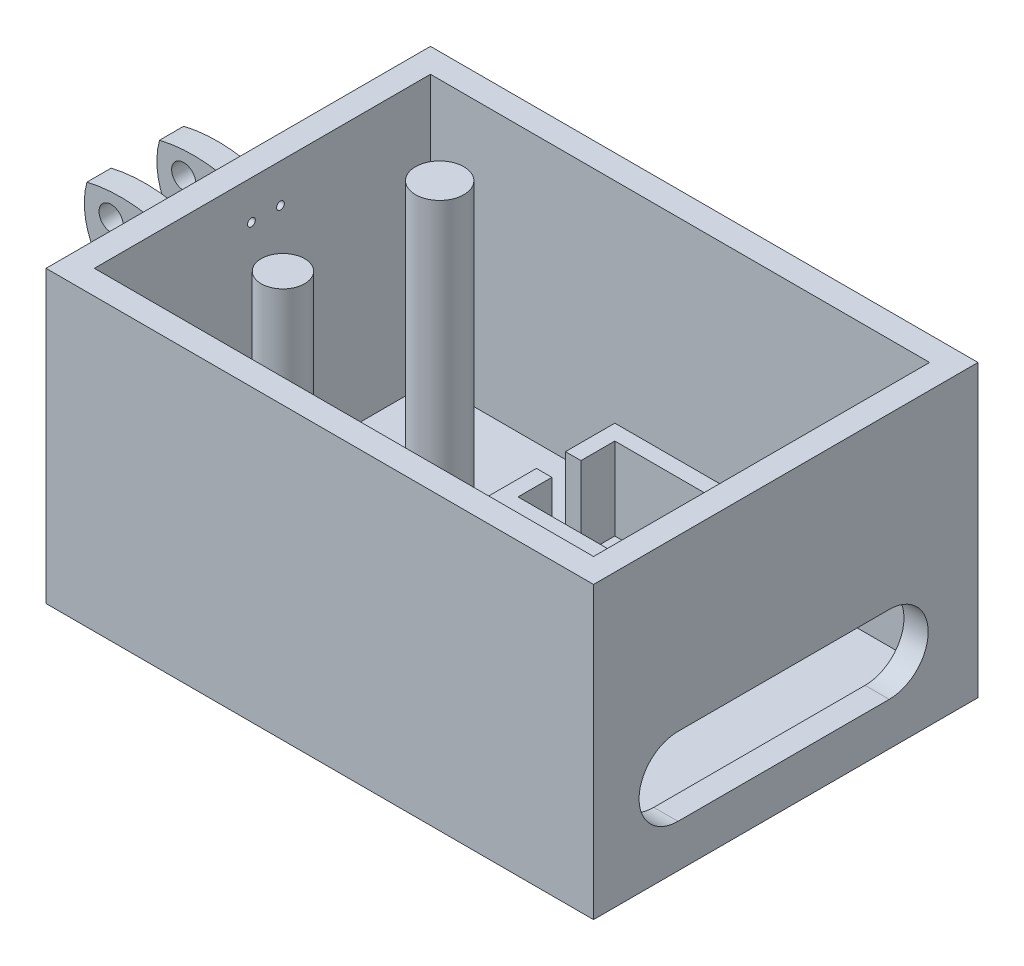
from build123d import *

# Parameters (mm, degrees)
BOSS_EXTRUDE1_DEPTH     = 38.1
CUT_EXTRUDE1_DEPTH      = 34.925
SERVO_BOX_1_DEPTH       = 13.97
SERVO_BOX_2_DEPTH       = 13.97
SKETCH36_R              = 1.5875
RING_ATTACHMENT_DEPTH   = 19.05
ATTACHMENT_TRIM_DEPTH   = 25.4
SKETCH33_R              = 0.508
RING_FINGER_HOLES_DEPTH = 31.75
CORD_HOLE_DEPTH         = 44.45
RING_HOOK_DEPTH         = 19.05
MIDDLE_HOOK_DEPTH       = 19.05
MIDDLE_HOOK_2_DEPTH     = 19.05
SKETCH57_W              = 6.44385504
SKETCH57_H              = 7.30367128
MIDDLE_HOOK_CUT_1_DEPTH = 19.05
SKETCH65_W              = 5.804806401
SKETCH65_H              = 9.582838289
SKETCH65_H_2            = 6.985
SKETCH65_W_2            = 10.36865681
SKETCH65_H_3            = 26.914043033
CUT_EXTRUDE9_DEPTH      = 15.24
CUT_EXTRUDE10_DEPTH     = 50.8
SKETCH67_R              = 2.848989685
SKETCH67_R_2            = 3.175
BOSS_EXTRUDE2_DEPTH     = 38.1


with BuildPart() as part:
    # Sketch2 → Boss-Extrude1 (new body)
    with BuildSketch(Plane(origin=(0, 0, 0), x_dir=(1, 0, 0), z_dir=(0, 1, 0))):
        with BuildLine():
            Line((-20.778406205, 52.758673202), (-36.188953289, 52.758673202))
            Line((-36.188953289, 52.758673202), (-36.188953289, 33.708673202))
            Line((-36.188953289, 33.708673202), (-38.864171838, 27.358673202))
            Line((-38.864171838, 27.358673202), (-48.947687906, 27.358673202))
            Line((-48.947687906, 27.358673202), (-48.947687906, 8.308673202))
            Line((-48.947687906, 8.308673202), (-48.947687906, -42.491326798))
            Line((-48.947687906, -42.491326798), (-42.959403849, -42.491326798))
            ThreePointArc((-42.959403849, -42.491326798), (-29.448791922, -45.239401215), (-16.422067996, -49.755263412))
            ThreePointArc((-16.422067996, -49.755263412), (-10.441569813, -54.6928899), (-3.738179712, -58.593027718))
            Line((-3.738179712, -58.593027718), (-3.738179712, -63.210333869))
            Line((-3.738179712, -63.210333869), (15.311820288, -63.210333869))
            ThreePointArc((15.311820288, -63.210333869), (19.123708761, -63.010602415), (22.909801598, -62.524919994))
            Line((22.909801598, -62.524919994), (22.909801598, 48.896004027))
            ThreePointArc((22.909801598, 48.896004027), (1.17082788, 52.016399628), (-20.778406205, 52.758673202))
        make_face()
    extrude(amount=BOSS_EXTRUDE1_DEPTH)

    # Sketch3 → Cut-Extrude1 (cut)
    with BuildSketch(Plane(origin=(0, 38.1, 0), x_dir=(1, 0, 0), z_dir=(0, 1, 0))):
        Polygon((-45.772687906, 24.183673202), (19.734801598, 24.183673202), (19.734801598, -19.921590233), (-45.772687906, -19.921590233), (-45.772687906, 7.713042295), align=None)
        with BuildLine():
            Line((-38.864171838, 27.358673202), (22.909801598, 27.358673202))
            ThreePointArc((22.909801598, 27.358673202), (-7.97718512, 133.680362497), (-38.864171838, 27.358673202))
        make_face()
        with BuildLine():
            Line((-48.947687906, -23.096590233), (22.909801598, -23.096590233))
            ThreePointArc((22.909801598, -23.096590233), (35.616611998, -147.942668358), (-48.947687906, -55.22327753))
            Line((-48.947687906, -55.22327753), (-48.947687906, -23.096590233))
        make_face()
    extrude(amount=-CUT_EXTRUDE1_DEPTH, mode=Mode.SUBTRACT)

    # Sketch6 → Servo Box 1 (add)
    with BuildSketch(Plane(origin=(0, 0, 0), x_dir=(1, 0, 0), z_dir=(0, 1, 0))):
        Polygon((-18.154039747, -9.466732857), (-16.122039747, -9.466732857), (-16.122039747, -13.911732857), (8.007960253, -13.911732857), (8.007960253, -9.466732857), (10.039960253, -9.466732857), (10.039960253, -15.943732857), (-18.154039747, -15.943732857), align=None)
        Polygon((8.007960253, -1.211732857), (-16.122039747, -1.211732857), (-16.122039747, -5.656732857), (-18.154039747, -5.656732857), (-18.154039747, 0.820267143), (10.039960253, 0.820267143), (10.039960253, -5.656732857), (8.007960253, -5.656732857), align=None)
    extrude(amount=SERVO_BOX_1_DEPTH)

    # Sketch7 → Servo Box 2 (add)
    with BuildSketch(Plane(origin=(0, 0, 0), x_dir=(1, 0, 0), z_dir=(0, 1, 0))):
        Polygon((-18.154039747, 10.472267143), (-16.122039747, 10.472267143), (-16.122039747, 6.027267143), (8.007960253, 6.027267143), (8.007960253, 10.472267143), (10.039960253, 10.472267143), (10.039960253, 3.995267143), (-18.154039747, 3.995267143), align=None)
        Polygon((8.007960253, 18.727267143), (-16.122039747, 18.727267143), (-16.122039747, 14.282267143), (-18.154039747, 14.282267143), (-18.154039747, 20.759267143), (10.039960253, 20.759267143), (10.039960253, 14.282267143), (8.007960253, 14.282267143), align=None)
    extrude(amount=SERVO_BOX_2_DEPTH)

    # Sketch36 → Ring Attachment (add)
    with BuildSketch(Plane(origin=(0, 0, -12.118673202), x_dir=(-1, 0, 0), z_dir=(0, 0, -1))):
        with BuildLine():
            Line((48.947687906, 29.21), (48.947687906, 18.074207691))
            Line((48.947687906, 18.074207691), (53.392687906, 18.074207691))
            Line((53.392687906, 18.074207691), (59.742687906, 18.074207691))
            Line((59.742687906, 18.074207691), (59.742687906, 21.249207691))
            ThreePointArc((59.742687906, 21.249207691), (62.80538306, 25.776891551), (62.917687906, 31.242))
            ThreePointArc((62.917687906, 31.242), (55.737515168, 31.567812574), (48.947687906, 29.21))
        make_face()
        with Locations((59.742687906, 28.707395517)):
            Circle(SKETCH36_R, mode=Mode.SUBTRACT)
    extrude(amount=-RING_ATTACHMENT_DEPTH)

    # Sketch40 → Attachment Trim (cut)
    with BuildSketch(Plane(origin=(0, 38.1, 0), x_dir=(1, 0, 0), z_dir=(0, 1, 0))):
        with BuildLine():
            Line((-48.947687906, -6.931326798), (-48.947687906, -3.756326798))
            Line((-48.947687906, -3.756326798), (-65.361733155, -3.756326798))
            Line((-65.361733155, -3.756326798), (-65.361733155, -0.581326798))
            Line((-65.361733155, -0.581326798), (-48.947687906, -0.581326798))
            Line((-48.947687906, -0.581326798), (-48.947687906, 5.768673202))
            Line((-48.947687906, 5.768673202), (-65.776264763, 5.768673202))
            Line((-65.776264763, 5.768673202), (-65.776264763, 8.943673202))
            Line((-65.776264763, 8.943673202), (-48.947687906, 8.943673202))
            Line((-48.947687906, 8.943673202), (-48.947687906, 12.118673202))
            ThreePointArc((-48.947687906, 12.118673202), (-80.34840255, 2.593673202), (-48.947687906, -6.931326798))
        make_face()
    extrude(amount=-ATTACHMENT_TRIM_DEPTH, mode=Mode.SUBTRACT)

    # Sketch33 → Ring Finger Holes (cut)
    with BuildSketch(Plane(origin=(-69.85, 0, 0), x_dir=(0, 0, -1), z_dir=(1, 0, 0))):
        with Locations((0.688673202, 33.02)):
            Circle(SKETCH33_R)
        with Locations((4.498673202, 33.02)):
            Circle(SKETCH33_R)
    extrude(amount=RING_FINGER_HOLES_DEPTH, mode=Mode.SUBTRACT)

    # Sketch41 → Cord Hole (cut)
    with BuildSketch(Plane(origin=(62.913848002, 0, 0), x_dir=(0, 0, -1), z_dir=(1, 0, 0))):
        with BuildLine():
            Line((-12.016652412, 15.851932983), (15.710210154, 15.851932983))
            ThreePointArc((15.710210154, 15.851932983), (20.818250673, 10.743892464), (15.710210154, 5.635851946))
            Line((15.710210154, 5.635851946), (-12.016652412, 5.635851946))
            ThreePointArc((-12.016652412, 5.635851946), (-17.12469293, 10.743892464), (-12.016652412, 15.851932983))
        make_face()
    extrude(amount=-CORD_HOLE_DEPTH, mode=Mode.SUBTRACT)

    # Sketch52 → Ring Hook (add)
    with BuildSketch(Plane(origin=(0, 0, -12.118673202), x_dir=(-1, 0, 0), z_dir=(0, 0, -1))):
        with BuildLine():
            Line((52.079417812, 6.575838366), (48.947687906, 6.798773562))
            Line((48.947687906, 6.798773562), (48.947687906, 3.681759929))
            ThreePointArc((48.947687906, 3.681759929), (50.154592803, 4.494095024), (51.56202319, 4.862398487))
            ThreePointArc((51.56202319, 4.862398487), (52.595162873, 4.406515303), (53.259394348, 3.493277311))
            ThreePointArc((53.259394348, 3.493277311), (52.80871858, 2.435311228), (51.875495098, 1.763377592))
            ThreePointArc((51.875495098, 1.763377592), (51.337693114, 2.052625855), (51.280629769, 2.660605548))
            ThreePointArc((51.280629769, 2.660605548), (50.525041175, 3.111212192), (50.07443453, 2.355623598))
            ThreePointArc((50.07443453, 2.355623598), (50.521061084, 1.129253272), (51.719490009, 0.612312688))
            ThreePointArc((51.719490009, 0.612312688), (54.01907529, 1.640613281), (54.717115143, 4.060992371))
            ThreePointArc((54.717115143, 4.060992371), (53.825637568, 5.766663725), (52.079417812, 6.575838366))
        make_face()
    extrude(amount=-RING_HOOK_DEPTH)


with BuildPart() as body_2:
    # Sketch56 → Middle Hook (new body)
    with BuildSketch(Plane(origin=(0, 0, 13.281326798), x_dir=(-1, 0, 0), z_dir=(0, 0, -1))):
        with BuildLine():
            Line((59.307557511, 8.89), (56.767557511, 8.89))
            Line((56.767557511, 8.89), (56.767557511, 12.007013633))
            ThreePointArc((56.767557511, 12.007013633), (57.832492224, 10.713868099), (59.307557511, 9.919831756))
            ThreePointArc((59.307557511, 9.919831756), (60.589681431, 10.520271405), (61.228710278, 11.783604952))
            ThreePointArc((61.228710278, 11.783604952), (60.623886944, 13.07409489), (59.342790307, 13.69856823))
            ThreePointArc((59.342790307, 13.69856823), (58.957508965, 13.481176717), (58.80220943, 13.066951131))
            ThreePointArc((58.80220943, 13.066951131), (58.461789356, 12.706641867), (58.101480093, 13.047061941))
            ThreePointArc((58.101480093, 13.047061941), (58.440138088, 13.935120258), (59.307557511, 14.323604952))
            ThreePointArc((59.307557511, 14.323604952), (61.228626965, 13.52787193), (62.024359987, 11.606802476))
            ThreePointArc((62.024359987, 11.606802476), (61.228626965, 9.685733022), (59.307557511, 8.89))
        make_face()
    extrude(amount=-MIDDLE_HOOK_DEPTH)

    # Sketch57 → Middle Hook Cut 1 (cut)
    with BuildSketch(Plane(origin=(0, 0, 13.281326798), x_dir=(-1, 0, 0), z_dir=(0, 0, -1))):
        with Locations((59.989485031, 11.404925675)):
            Rectangle(SKETCH57_W, SKETCH57_H)
    extrude(amount=-MIDDLE_HOOK_CUT_1_DEPTH, mode=Mode.SUBTRACT)


with BuildPart() as body_3:
    # Sketch56 → Middle Hook 2 (new body)
    with BuildSketch(Plane(origin=(0, 0, 13.281326798), x_dir=(-1, 0, 0), z_dir=(0, 0, -1))):
        with BuildLine():
            Line((59.307557511, 6.798773562), (56.767557511, 6.798773562))
            Line((56.767557511, 6.798773562), (56.767557511, 3.681759929))
            ThreePointArc((56.767557511, 3.681759929), (57.832492224, 4.974905464), (59.307557511, 5.768941806))
            ThreePointArc((59.307557511, 5.768941806), (60.589681431, 5.168502157), (61.228710278, 3.905168611))
            ThreePointArc((61.228710278, 3.905168611), (60.623886944, 2.614678673), (59.342790307, 1.990205333))
            ThreePointArc((59.342790307, 1.990205333), (58.957508965, 2.207596845), (58.80220943, 2.621822432))
            ThreePointArc((58.80220943, 2.621822432), (58.461789356, 2.982131695), (58.101480093, 2.641711621))
            ThreePointArc((58.101480093, 2.641711621), (58.440138088, 1.753653304), (59.307557511, 1.365168611))
            ThreePointArc((59.307557511, 1.365168611), (61.228626965, 2.160901633), (62.024359987, 4.081971086))
            ThreePointArc((62.024359987, 4.081971086), (61.228626965, 6.00304054), (59.307557511, 6.798773562))
        make_face()
    extrude(amount=-MIDDLE_HOOK_2_DEPTH)


with BuildPart() as cut_extrude9_tool:
    # Sketch65 → Cut-Extrude9 (new body)
    with BuildSketch(Plane(origin=(0, 0, 0), x_dir=(1, 0, 0), z_dir=(0, 1, 0))):
        with Locations((-51.850091107, 9.925092347)):
            Rectangle(SKETCH65_W, SKETCH65_H)
        with Locations((-51.850091107, -3.438826798)):
            Rectangle(SKETCH65_W, SKETCH65_H_2)
        with Locations((-59.388818787, -23.035181565)):
            Rectangle(SKETCH65_W_2, SKETCH65_H_3)
    extrude(amount=CUT_EXTRUDE9_DEPTH)


with BuildPart() as part_1:
    add(part.part)

    # Cut-Extrude9: cut by cut_extrude9_tool
    add(cut_extrude9_tool.part, mode=Mode.SUBTRACT)

    # Sketch66 → Cut-Extrude10 (cut)
    with BuildSketch(Plane(origin=(0, 38.1, 0), x_dir=(1, 0, 0), z_dir=(0, 1, 0))):
        with BuildLine():
            Line((-48.947687906, -23.096590233), (22.909801598, -23.096590233))
            ThreePointArc((22.909801598, -23.096590233), (-13.018943154, -212.453183119), (-48.947687906, -23.096590233))
        make_face()
        with BuildLine():
            Line((22.909801598, 27.358673202), (-48.947687906, 27.358673202))
            ThreePointArc((-48.947687906, 27.358673202), (-13.018943154, 126.14838829), (22.909801598, 27.358673202))
        make_face()
    extrude(amount=-CUT_EXTRUDE10_DEPTH, mode=Mode.SUBTRACT)

    # Sketch67 → Boss-Extrude2 (add)
    with BuildSketch(Plane(origin=(0, 38.1, 0), x_dir=(1, 0, 0), z_dir=(0, 1, 0))):
        with Locations((-33.072687906, -7.879232857)):
            Circle(SKETCH67_R)
        with Locations((-33.072687906, 12.694767143)):
            Circle(SKETCH67_R_2)
    extrude(amount=-BOSS_EXTRUDE2_DEPTH)


with BuildPart() as body_3_1:
    add(body_3.part)

    # Cut-Extrude9: cut by cut_extrude9_tool
    add(cut_extrude9_tool.part, mode=Mode.SUBTRACT)


solid = part_1.part
